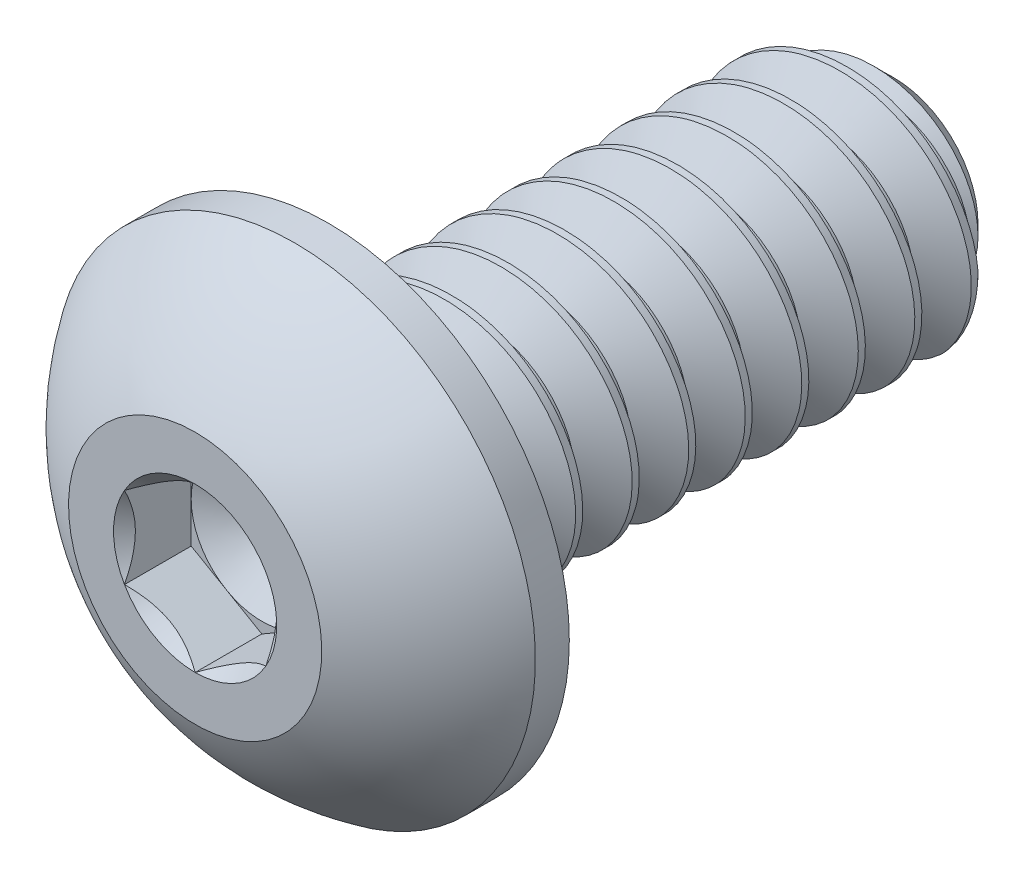
from build123d import *

# Parameters (mm, degrees)
SKETCH1_W          = 6.35
SKETCH1_H          = 1.4224
CHAMFER1_SIZE      = 0.47625
CUT_SWEEP1_PITCH   = 0.635
SKETCH4_R          = 2.7051
EXTRUDE1_DEPTH     = 1.4986
CUT_EXTRUDE1_DEPTH = 0.7493
SKETCH7_R          = 0.916543552
CUT_EXTRUDE4_DEPTH = 0.7493
CUT_EXTRUDE4_DRAFT = -45
SKETCH8_R          = 0.79375
CUT_EXTRUDE5_DEPTH = 0.249766667
CUT_EXTRUDE5_DRAFT = -60


with BuildPart() as part:
    # Sketch1 → Revolve1 (revolve)
    with BuildSketch(Plane(origin=(0, 0, 0), x_dir=(0, 0, -1), z_dir=(1, 0, 0))):
        with Locations((3.175, 0.7112)):
            Rectangle(SKETCH1_W, SKETCH1_H)
    revolve(axis=Axis((0, 0, 0), (0, 0, 1)))

    # Chamfer1
    chamfer1_edges = [part.edges().sort_by_distance(p)[0] for p in [
        (0, -1.4224, -6.35),
    ]]
    chamfer(chamfer1_edges, length=CHAMFER1_SIZE)

    # Cut-Sweep1: arcs per turn and ends read off the stored shape
    # Cut-Sweep1: the profile of Sketch10 profile screwed along a right-hand helix through 15 turns, 6 arcs to a turn; built about Z, then put on its axis
    cut_sweep1_z = Axis((0, 0, 0), (0, 0, 1))
    cut_sweep1_corners = [(1.4227, 0, -0.079201795), (1.4227, 0, -0.635173205), (1.009955401, 0, -0.396875), (1.009955401, 0, -0.3175)]
    with BuildLine(mode=Mode.PRIVATE) as cut_sweep1_profile:
        Line(cut_sweep1_corners[0], cut_sweep1_corners[1])
        Line(cut_sweep1_corners[1], cut_sweep1_corners[2])
        Line(cut_sweep1_corners[2], cut_sweep1_corners[3])
        Line(cut_sweep1_corners[3], cut_sweep1_corners[0])
    cut_sweep1_cap = Face(cut_sweep1_profile.wire())
    cut_sweep1_turn_angles = [0, 30, 60, 90, 120, 150, 180, 210, 240, 270, 300, 330, 360]
    cut_sweep1_turn_weights = [1, 0.8660254037844387, 1, 0.8660254037844387, 1, 0.8660254037844387, 1, 0.8660254037844387, 1, 0.8660254037844387, 1, 0.8660254037844387, 1]
    cut_sweep1_turn_rails = [Edge.make_bspline([Vector(p[0], p[1], 0).rotate(cut_sweep1_z, cut_sweep1_turn_angles[k]) / cut_sweep1_turn_weights[k] + Vector(0, 0, p[2] + CUT_SWEEP1_PITCH * cut_sweep1_turn_angles[k] / 360) for k in range(13)], [0, 0, 0, 1, 1, 2, 2, 3, 3, 4, 4, 5, 5, 6, 6, 6], 2, cut_sweep1_turn_weights) for p in cut_sweep1_corners]
    cut_sweep1_turn_sides = [Face.make_surface_from_curves(cut_sweep1_turn_rails[p[0]], cut_sweep1_turn_rails[p[1]]) for p in [(0, 1), (1, 2), (2, 3), (3, 0)]]
    cut_sweep1 = Plane(origin=(0, 0, -6.35), x_dir=(0.7071067811865488, 0.7071067811865464, 0), z_dir=(0, 0, 1)) * Solid(Shell([*[p.moved(Location((0, 0, CUT_SWEEP1_PITCH * i))) for i in range(15) for p in cut_sweep1_turn_sides], cut_sweep1_cap, cut_sweep1_cap.rotate(cut_sweep1_z, 5400).moved(Location((0, 0, CUT_SWEEP1_PITCH * 5400 / 360)))]))
    add(cut_sweep1, mode=Mode.SUBTRACT)

    # Sketch4 → Extrude1 (add)
    with BuildSketch(Plane.XY):
        Circle(SKETCH4_R)
    extrude(amount=EXTRUDE1_DEPTH)

    # Sketch9 → Cut-Revolve3 (revolve, cut)
    with BuildSketch(Plane(origin=(0, 0, 0), x_dir=(0, 0, -1), z_dir=(1, 0, 0)), mode=Mode.PRIVATE) as cut_revolve3_sk:
        with BuildLine():
            Line((0, 2.7051), (-0.381, 2.7051))
            ThreePointArc((-0.381, 2.7051), (-1.025093234, 2.138064897), (-1.4986, 1.4224))
            Line((-1.4986, 1.4224), (-1.8796, 1.4224))
            Line((-1.8796, 1.4224), (-1.8796, 3.0861))
            Line((-1.8796, 3.0861), (0, 3.0861))
            Line((0, 3.0861), (0, 2.7051))
        make_face()
    revolve(cut_revolve3_sk.sketch.rotate(Axis((0, 0, 0), (0, 0, 1)), 170.90536533), axis=Axis((0, 0, 0), (0, 0, 1)), mode=Mode.SUBTRACT)

    # Sketch6 → Cut-Extrude1 (cut)
    with BuildSketch(Plane.XY.offset(1.4986)):
        Polygon((0, -0.916543552), (0.79375, -0.458271776), (0.79375, 0.458271776), (0, 0.916543552), (-0.79375, 0.458271776), (-0.79375, -0.458271776), align=None)
    extrude(amount=-CUT_EXTRUDE1_DEPTH, mode=Mode.SUBTRACT)


with BuildPart() as cut_extrude4_tool:
    # Sketch7 → Cut-Extrude4 (with draft: the straight prism first)
    with BuildSketch(Plane.XY.offset(1.4986)):
        Circle(SKETCH7_R)
    extrude(amount=-CUT_EXTRUDE4_DEPTH)
    # Cut-Extrude4: the draft: its side faces are tilted about the plane it starts from
    cut_extrude4_sides = [cut_extrude4_tool.faces().sort_by_distance(p)[0] for p in [
        (-0.916543552, 0, 1.12395),
    ]]
    draft(cut_extrude4_sides, Plane.XY.offset(1.4986), CUT_EXTRUDE4_DRAFT)


with BuildPart() as part_1:
    add(part.part)

    # Cut-Extrude4: cut by cut_extrude4_tool
    add(cut_extrude4_tool.part, mode=Mode.SUBTRACT)


with BuildPart() as cut_extrude5_tool:
    # Sketch8 → Cut-Extrude5 (with draft: the straight prism first)
    with BuildSketch(Plane.XY.offset(0.7493)):
        Circle(SKETCH8_R)
    extrude(amount=-CUT_EXTRUDE5_DEPTH)
    # Cut-Extrude5: the draft: its side faces are tilted about the plane it starts from
    cut_extrude5_sides = [cut_extrude5_tool.faces().sort_by_distance(p)[0] for p in [
        (-0.79375, 0, 0.624416667),
    ]]
    draft(cut_extrude5_sides, Plane.XY.offset(0.7493), CUT_EXTRUDE5_DRAFT)


with BuildPart() as part_2:
    add(part_1.part)

    # Cut-Extrude5: cut by cut_extrude5_tool
    add(cut_extrude5_tool.part, mode=Mode.SUBTRACT)


solid = part_2.part
